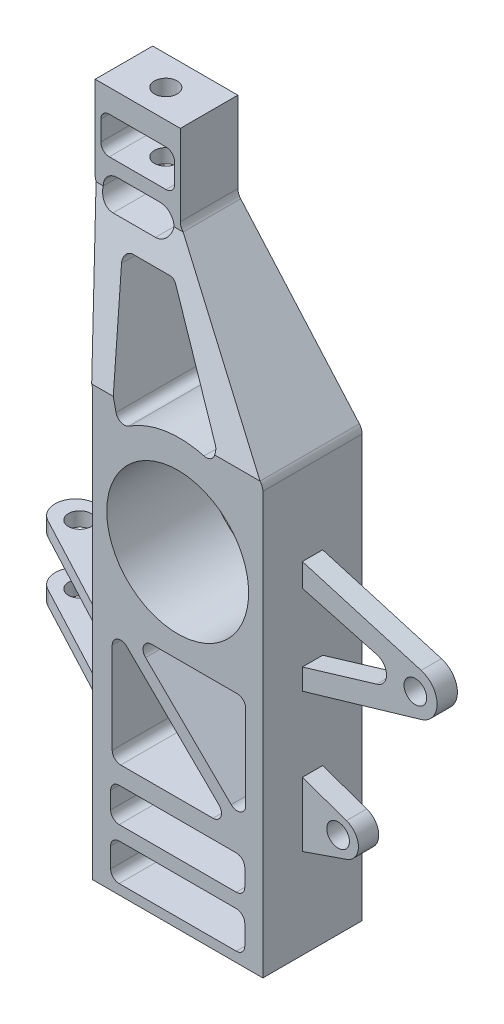
from build123d import *

# Parameters (mm, degrees)
BOSS_EXTRUDE1_DEPTH = 17.5
SKETCH6_W           = 24.942027916
SKETCH6_H           = 10
SKETCH6_W_2         = 47.258134024
SKETCH6_H_2         = 13
SKETCH6_H_3         = 12
SKETCH6_W_3         = 26
CUT_EXTRUDE1_DEPTH  = 228.033901494
SKETCH7_R           = 25
CUT_EXTRUDE2_DEPTH  = 228.033901494
SKETCH8_R           = 4
CUT_EXTRUDE3_DEPTH  = 30
SKETCH10_R          = 4
CUT_EXTRUDE4_DEPTH  = 30
SKETCH11_W          = 7.160304618
SKETCH11_H          = 39.552070702
SKETCH11_H_2        = 22.637315958
BOSS_EXTRUDE2_DEPTH = 50
SKETCH13_R          = 4
CUT_EXTRUDE5_DEPTH  = 50
CUT_EXTRUDE6_DEPTH  = 50
CUT_EXTRUDE7_DEPTH  = 50
BOSS_EXTRUDE3_DEPTH = 70
SKETCH19_R          = 4
CUT_EXTRUDE8_DEPTH  = 70
FILLET4_R           = 5
CUT_EXTRUDE11_DEPTH = 250.744819662
FILLET5_R           = 3
FILLET6_R           = 3
CUT_EXTRUDE12_DEPTH = 250.744819662
FILLET9_R           = 3
CUT_EXTRUDE13_DEPTH = 247.600171616
FILLET10_R          = 3
CUT_EXTRUDE14_DEPTH = 50
FILLET11_R          = 4
CUT_EXTRUDE16_DEPTH = 100


with BuildPart() as part:
    # Sketch1 → Boss-Extrude1 (new, symmetric)
    with BuildSketch(Plane.XY):
        Polygon((30, -10), (-30, -10), (-30, 140), (-43.810871114, 190), (-43.810871114, 220), (-13.810871114, 220), (-13.810871114, 190), (30, 140), align=None)
    extrude(amount=BOSS_EXTRUDE1_DEPTH, both=True)

    # Sketch6 → Cut-Extrude1 (cut, through all)
    with BuildSketch(Plane(origin=(0, 0, -17.5), x_dir=(-1, 0, 0), z_dir=(0, 0, -1))):
        with Locations((28.506361164, 188.88472005)):
            Rectangle(SKETCH6_W, SKETCH6_H)
        Rectangle(SKETCH6_W_2, SKETCH6_H_2)
        with Locations((0, 17.5)):
            Rectangle(SKETCH6_W_2, SKETCH6_H_3)
        with Locations((28.85405418, 205.307263481)):
            Rectangle(SKETCH6_W_3, SKETCH6_H_2)
    extrude(amount=-CUT_EXTRUDE1_DEPTH, mode=Mode.SUBTRACT)

    # Sketch7 → Cut-Extrude2 (cut, through all)
    with BuildSketch(Plane(origin=(0, 0, -17.5), x_dir=(-1, 0, 0), z_dir=(0, 0, -1))):
        with Locations((0, 105)):
            Circle(SKETCH7_R)
    extrude(amount=-CUT_EXTRUDE2_DEPTH, mode=Mode.SUBTRACT)

    # Sketch8 → Cut-Extrude3 (cut)
    with BuildSketch(Plane(origin=(0, 220, 0), x_dir=(1, 0, 0), z_dir=(0, 1, 0))):
        with Locations(Location((-28.860081831, 7.158757746, 0), (0, 0, 270))):
            Circle(SKETCH8_R)
    extrude(amount=-CUT_EXTRUDE3_DEPTH, mode=Mode.SUBTRACT)

    # Sketch10 → Cut-Extrude4 (cut)
    with BuildSketch(Plane.XZ.offset(10)):
        Circle(SKETCH10_R)
    extrude(amount=-CUT_EXTRUDE4_DEPTH, mode=Mode.SUBTRACT)

    # Sketch11 → Boss-Extrude2 (add)
    with BuildSketch(Plane(origin=(30, 0, 0), x_dir=(0, 0, -1), z_dir=(1, 0, 0))):
        with Locations((-0.000773436, 90.343921661)):
            Rectangle(SKETCH11_W, SKETCH11_H)
        with Locations((-0.000773436, 32.969473472)):
            Rectangle(SKETCH11_W, SKETCH11_H_2)
    extrude(amount=BOSS_EXTRUDE2_DEPTH)

    # Sketch13 → Cut-Extrude5 (cut)
    with BuildSketch(Plane.XY.offset(3.580925745)):
        with Locations((69.802457577, 90.343921661)):
            Circle(SKETCH13_R)
        with Locations((42.591748381, 32.969473472)):
            Circle(SKETCH13_R)
    extrude(amount=-CUT_EXTRUDE5_DEPTH, mode=Mode.SUBTRACT)

    # Sketch14 → Cut-Extrude6 (cut)
    with BuildSketch(Plane.XY.offset(3.580925745)):
        with BuildLine():
            Line((30, 110.119957012), (71.857382865, 97.843921661))
            ThreePointArc((71.857382865, 97.843921661), (77.47366635, 90.343921661), (71.857382865, 82.843921661))
            Line((71.857382865, 82.843921661), (30, 70.56788631))
            Line((30, 70.56788631), (80, 70.56788631))
            Line((80, 70.56788631), (80, 110.119957012))
            Line((80, 110.119957012), (30, 110.119957012))
        make_face()
    extrude(amount=-CUT_EXTRUDE6_DEPTH, mode=Mode.SUBTRACT)

    # Sketch15 → Cut-Extrude7 (cut)
    with BuildSketch(Plane.XY.offset(3.580925745)):
        with BuildLine():
            Line((30, 44.288131451), (80, 44.288131451))
            Line((80, 44.288131451), (80, 21.650815493))
            Line((80, 21.650815493), (30, 21.650815493))
            Line((30, 21.650815493), (45.536546747, 27.022566957))
            ThreePointArc((45.536546747, 27.022566957), (49.751512, 32.928989945), (45.556761025, 38.849786248))
            Line((45.556761025, 38.849786248), (30, 44.288131451))
        make_face()
    extrude(amount=-CUT_EXTRUDE7_DEPTH, mode=Mode.SUBTRACT)

    # Sketch18 → Boss-Extrude3 (add)
    with BuildSketch(Plane.ZY.offset(30)):
        Polygon((11.672732765, 47), (-11.672732765, 47), (-45.527572918, 47), (-45.527572918, 42), (-11.672732765, 42), (11.672732765, 42), align=None)
        Polygon((-11.672732765, 26), (-45.212973929, 26), (-45.212973929, 21), (-11.672732765, 21), (11.672732765, 21), (11.672732765, 26), align=None)
    extrude(amount=BOSS_EXTRUDE3_DEPTH)

    # Sketch19 → Cut-Extrude8 (cut)
    with BuildSketch(Plane(origin=(0, 47, 0), x_dir=(1, 0, 0), z_dir=(0, 1, 0))):
        with Locations(Location((-85, 33, 0), (0, 0, 270))):
            Circle(SKETCH19_R)
    extrude(amount=-CUT_EXTRUDE8_DEPTH, mode=Mode.SUBTRACT)

    # Fillet4
    fillet4_edges = [part.edges().sort_by_distance(p)[0] for p in [
        (-40.977375122, 183.88472005, 0),
        (-16.035347206, 183.88472005, 0),
        (-16.035347206, 193.88472005, 0),
        (-40.977375122, 193.88472005, 0),
    ]]
    fillet(fillet4_edges, radius=FILLET4_R - 0.0001)  # a hair under: the kernel refuses the full size

    # Sketch24 → Cut-Extrude11 (cut, through all)
    with BuildSketch(Plane.XY.offset(17.5)):
        Polygon((-23.080104547, 29.96241896), (-23.080104547, 72.243295408), (19.739020818, 29.96241896), align=None)
        Polygon((-16.517242483, 72.243295408), (23.954637672, 72.243295408), (23.954637672, 32.280158612), align=None)
    extrude(amount=-CUT_EXTRUDE11_DEPTH, mode=Mode.SUBTRACT)

    # Fillet5
    fillet5_edges = [part.edges().sort_by_distance(p)[0] for p in [
        (-16.517242483, 72.243295408, 0),
        (23.954637672, 72.243295408, 0),
    ]]
    fillet(fillet5_edges, radius=FILLET5_R)

    # Fillet6
    fillet6_edges = [part.edges().sort_by_distance(p)[0] for p in [
        (23.954637672, 32.280158612, 0),
        (19.739020818, 29.96241896, 0),
        (-23.080104547, 29.96241896, 0),
        (-23.080104547, 72.243295408, 0),
    ]]
    fillet(fillet6_edges, radius=FILLET6_R)

    # Sketch25 → Cut-Extrude12 (cut, through all)
    with BuildSketch(Plane.XY.offset(17.5)):
        with BuildLine():
            Line((19.626327343, 134.005049283), (-12.289470121, 176.922125419))
            Line((-12.289470121, 176.922125419), (-30.503104083, 176.922125419))
            Line((-30.503104083, 176.922125419), (-20.751992176, 132.120430764))
            ThreePointArc((-20.751992176, 132.120430764), (-0.889923513, 140.07073059), (19.626327343, 134.005049283))
        make_face()
    extrude(amount=-CUT_EXTRUDE12_DEPTH, mode=Mode.SUBTRACT)

    # Fillet9
    fillet9_edges = [part.edges().sort_by_distance(p)[0] for p in [
        (19.626327343, 134.005049283, 0),
        (-20.751992176, 132.120430764, 0),
        (-30.503104083, 176.922125419, 0),
        (-12.289470121, 176.922125419, 0),
    ]]
    fillet(fillet9_edges, radius=FILLET9_R)

    # Sketch26 → Cut-Extrude13 (cut, through all)
    with BuildSketch(Plane.XY.offset(3.580925745)):
        with BuildLine():
            Line((30, 101.953158871), (56.185596991, 94.877842692))
            ThreePointArc((56.185596991, 94.877842692), (59.655725238, 90.345648843), (56.185596991, 85.813454995))
            Line((56.185596991, 85.813454995), (30, 77.952755802))
            Line((30, 77.952755802), (30, 101.953158871))
        make_face()
    extrude(amount=-CUT_EXTRUDE13_DEPTH, mode=Mode.SUBTRACT)

    # Fillet10
    fillet10_edges = [part.edges().sort_by_distance(p)[0] for p in [
        (23.629067012, -6.5, 0),
        (23.629067012, 6.5, 0),
        (-23.629067012, 6.5, 0),
        (-23.629067012, -6.5, 0),
        (-15.85405418, 198.807263481, 0),
        (-15.85405418, 211.807263481, 0),
        (-41.85405418, 211.807263481, 0),
        (-41.85405418, 198.807263481, 0),
        (23.629067012, 11.5, 0),
        (23.629067012, 23.5, 0),
        (-23.629067012, 23.5, 0),
        (-23.629067012, 11.5, 0),
    ]]
    fillet(fillet10_edges, radius=FILLET10_R)

    # Sketch29 → Cut-Extrude14 (cut)
    with BuildSketch(Plane.XZ.offset(-21)):
        with BuildLine():
            Line((-30, 4.855454999), (-90.46980655, -27.217712952))
            ThreePointArc((-90.46980655, -27.217712952), (-93.474418669, -37.006897491), (-83.685693812, -40.01300687))
            Line((-83.685693812, -40.01300687), (-30, -11.55916998))
            Line((-30, -11.55916998), (-30, -45.527572918))
            Line((-30, -45.527572918), (-100, -45.527572918))
            Line((-100, -45.527572918), (-100, 11.672732765))
            Line((-100, 11.672732765), (-30, 11.672732765))
            Line((-30, 11.672732765), (-30, 4.855454999))
        make_face()
    extrude(amount=-CUT_EXTRUDE14_DEPTH, mode=Mode.SUBTRACT)

    # Fillet11
    fillet11_edges = [part.edges().sort_by_distance(p)[0] for p in [
        (-30, 140, 0),
        (-43.810871114, 190, 0),
        (-13.810871114, 190, 0),
        (30, 140, 0),
    ]]
    fillet(fillet11_edges, radius=FILLET11_R)

    # Sketch31 → Cut-Extrude16 (cut)
    with BuildSketch(Plane(origin=(30, 0, 0), x_dir=(0, 0, -1), z_dir=(1, 0, 0))):
        Polygon((-17.5, 141.131578769), (-2.764763692, 188.868421231), (-2.764763692, 220), (-17.5, 220), align=None)
    extrude(amount=-CUT_EXTRUDE16_DEPTH, mode=Mode.SUBTRACT)


solid = part.part
